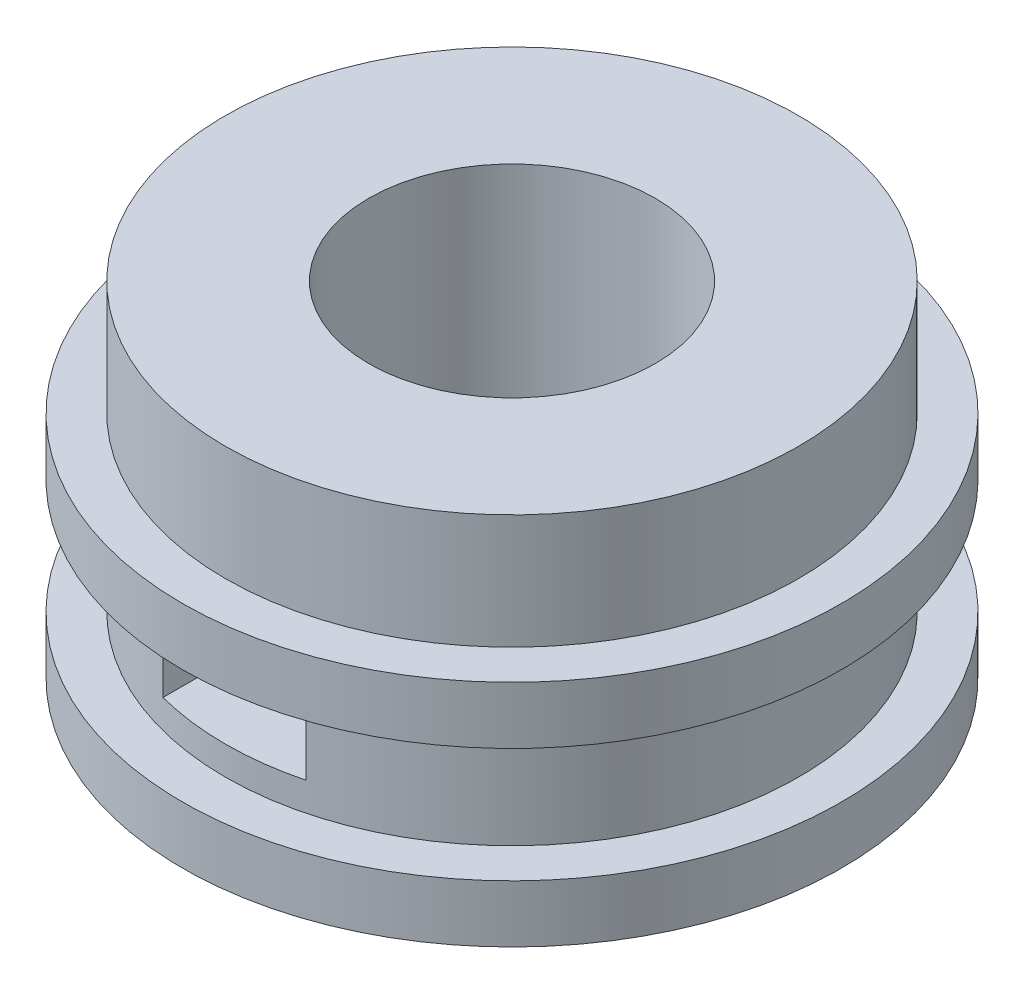
from build123d import *

# Parameters (mm, degrees)
BOSS_EXTRUDE1_DEPTH      = 4
BOSS_EXTRUDE1_DEPTH_BACK = 2
SKETCH1_R                = 5
SKETCH1_R_2              = 2.5
CUT_EXTRUDE1_DEPTH       = 9.124038405
CUT_EXTRUDE1_DEPTH_BACK  = 9.124038405
SKETCH2_W                = 2.5
SKETCH2_H                = 1
SKETCH3_R                = 5.75
SKETCH3_R_2              = 5
BOSS_EXTRUDE2_DEPTH      = 1
SKETCH5_R                = 5.75
SKETCH5_R_2              = 5
BOSS_EXTRUDE3_DEPTH      = 1


with BuildPart() as part:
    # Sketch1 → Boss-Extrude1 (new, two sides: drawn at the far end of the back side and taken through both)
    with BuildSketch(Plane(origin=(0, 0, 0), x_dir=(1, 0, 0), z_dir=(0, 1, 0)).offset(-BOSS_EXTRUDE1_DEPTH_BACK)):
        Circle(SKETCH1_R)
        Circle(SKETCH1_R_2, mode=Mode.SUBTRACT)
    extrude(amount=BOSS_EXTRUDE1_DEPTH + BOSS_EXTRUDE1_DEPTH_BACK)

    # Sketch2 → Cut-Extrude1 (cut, two sides: drawn at the far end of the back side and taken through both)
    with BuildSketch(Plane.XY.offset(-CUT_EXTRUDE1_DEPTH_BACK)):
        Rectangle(SKETCH2_W, SKETCH2_H)
    extrude(amount=CUT_EXTRUDE1_DEPTH + CUT_EXTRUDE1_DEPTH_BACK, mode=Mode.SUBTRACT)

    # Sketch3 → Boss-Extrude2 (add)
    with BuildSketch(Plane.XZ.offset(2)):
        Circle(SKETCH3_R)
        Circle(SKETCH3_R_2, mode=Mode.SUBTRACT)
    extrude(amount=-BOSS_EXTRUDE2_DEPTH)

    # Sketch5 → Boss-Extrude3 (add)
    with BuildSketch(Plane(origin=(0, 1, 0), x_dir=(1, 0, 0), z_dir=(0, 1, 0))):
        Circle(SKETCH5_R)
        Circle(SKETCH5_R_2, mode=Mode.SUBTRACT)
    extrude(amount=BOSS_EXTRUDE3_DEPTH)


solid = part.part
